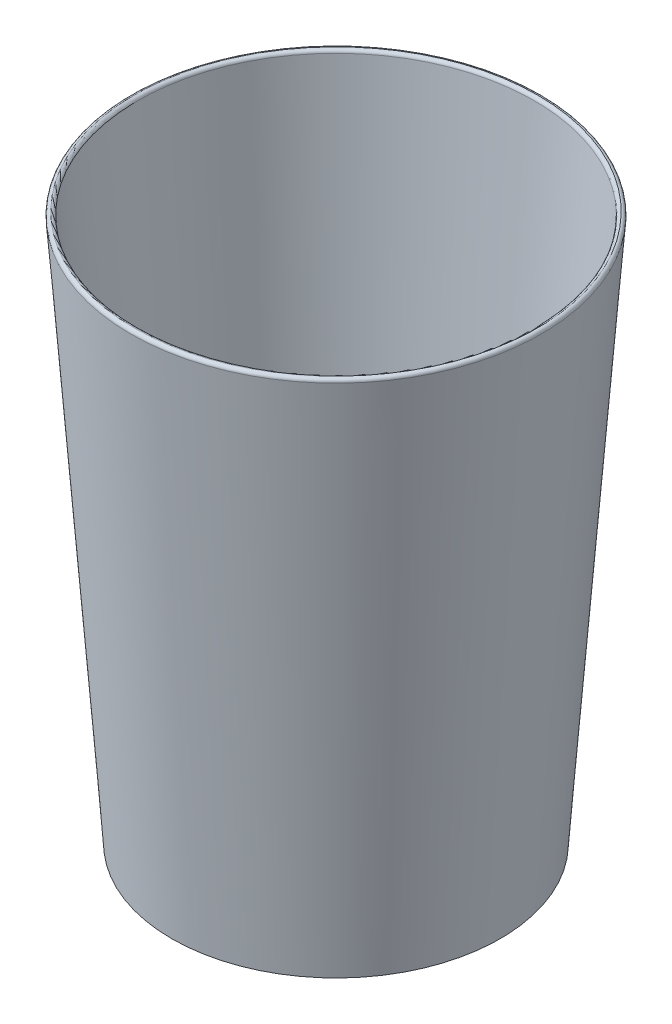
from build123d import *

# Parameters (mm, degrees)
VACIADO1_T  = -5
REDONDEO2_R = 2.5


with BuildPart() as part:
    # Croquis1 → Revolución1 (revolve)
    with BuildSketch(Plane.XY, mode=Mode.PRIVATE) as revoluci_n1_sk:
        Polygon((0, 400), (150, 400), (120, 0), (0, 0), align=None)
    revolve(revoluci_n1_sk.sketch.rotate(Axis((0, 0, 0), (0, 1, 0)), 90), axis=Axis((0, 0, 0), (0, 1, 0)))

    # Vaciado1
    vaciado1_openings = [part.faces().sort_by_distance(p)[0] for p in [
        (0, 400, 0),
    ]]
    offset(amount=VACIADO1_T, openings=vaciado1_openings, kind=Kind.INTERSECTION)

    # Redondeo2
    redondeo2_edges = [part.edges().sort_by_distance(p)[0] for p in [
        (0, 400, 150),
        (0, 400, 144.98595722),
    ]]
    fillet(redondeo2_edges, radius=REDONDEO2_R - 0.0001)  # a hair under: the kernel refuses the full size


solid = part.part
